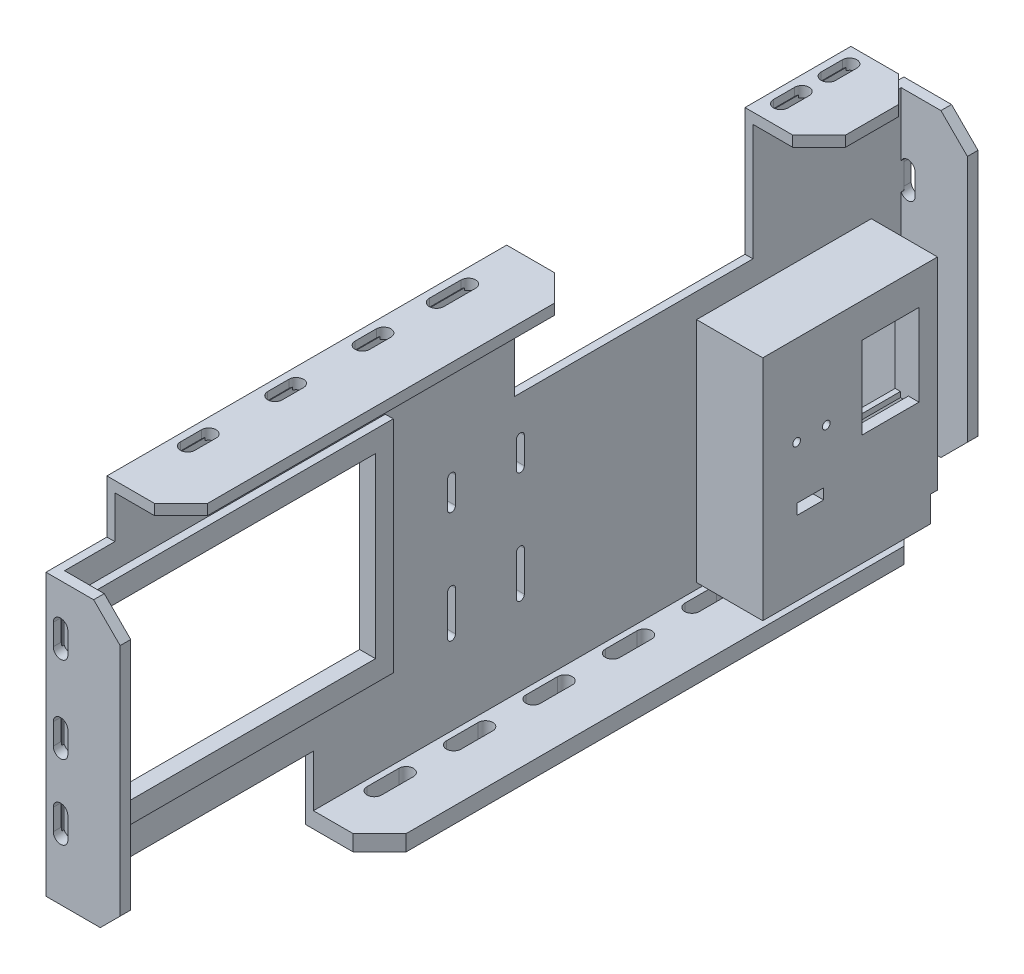
from build123d import *
from build123d.topology import SkipClean

# Parameters (mm, degrees)
SKETCH_1_W           = 80
SKETCH_1_H           = 97
SKETCH_1_W_2         = 60
SKETCH_1_H_2         = 77
EXTRUDE_1_DEPTH      = 6
SKETCH_2_W           = 60
SKETCH_2_H           = 10
EXTRUDE_2_DEPTH      = 25
SKETCH_3_W           = 60
SKETCH_3_H           = 77
EXTRUDE_3_DEPTH      = 4
SKETCH_4_W           = 21.5
SKETCH_4_H           = 31
CUT_EXTRUDE_1_DEPTH  = 4
SKETCH_5_W           = 25.5
SKETCH_5_H           = 35
SKETCH_5_W_2         = 21.5
SKETCH_5_H_2         = 31
EXTRUDE_4_DEPTH      = 5
SKETCH_6_W           = 3
SKETCH_6_H           = 21.5
CUT_EXTRUDE_2_DEPTH  = 37
SKETCH_7_W           = 18.2
SKETCH_7_H           = 30.1
CUT_EXTRUDE_3_DEPTH  = 1.5
SKETCH_8_R           = 1.45
CUT_EXTRUDE_5_DEPTH  = 4.5
FILLET_1_R           = 3
FILLET_2_R           = 3
SKETCH_9_R           = 2.75
CUT_EXTRUDE_6_DEPTH  = 10
SKETCH_10_W          = 60
SKETCH_10_H          = 5
CUT_EXTRUDE_7_DEPTH  = 20
SKETCH_11_W          = 60
SKETCH_11_H          = 10
EXTRUDE_5_DEPTH      = 5
SKETCH_12_R          = 2.7
CUT_EXTRUDE_8_DEPTH  = 5
SKETCH_13_W          = 21
SKETCH_13_H          = 3
CUT_EXTRUDE_9_DEPTH  = 80
SKETCH_14_W          = 174.976992902
SKETCH_14_H          = 186.642125763
CUT_EXTRUDE_11_DEPTH = 22
SKETCH_15_W          = 60
SKETCH_15_H          = 10
SKETCH_15_H_2        = 7
CUT_EXTRUDE_12_DEPTH = 22
SKETCH_19_W          = 328
SKETCH_19_H          = 155.5
SKETCH_19_W_2        = 320
SKETCH_19_H_2        = 147.5
EXTRUDE_6_DEPTH      = 28
SKETCH_20_W          = 66
SKETCH_20_H          = 86
SKETCH_20_W_2        = 60
SKETCH_20_H_2        = 80
EXTRUDE_7_DEPTH      = 28
SKETCH_21_W          = 328
SKETCH_21_H          = 155.5
SKETCH_21_W_2        = 66
SKETCH_21_H_2        = 86
EXTRUDE_8_DEPTH      = 3
CUT_EXTRUDE_13_DEPTH = 3
SKETCH_24_W          = 105.3
SKETCH_24_H          = 67.1
CUT_EXTRUDE_15_DEPTH = 3
SKETCH_26_W          = 121.3
SKETCH_26_H          = 83.1
SKETCH_26_W_2        = 105.3
SKETCH_26_H_2        = 67.1
EXTRUDE_11_DEPTH     = 3
SKETCH_27_W          = 100
SKETCH_27_H          = 25
CUT_EXTRUDE_16_DEPTH = 36
SKETCH_28_W          = 20
SKETCH_28_H          = 20
CUT_EXTRUDE_17_DEPTH = 36
SKETCH_29_W          = 22
SKETCH_29_H          = 22
SKETCH_29_W_2        = 25
CUT_EXTRUDE_18_DEPTH = 36
SKETCH_31_W          = 90
SKETCH_31_H          = 50
CUT_EXTRUDE_19_DEPTH = 36
SKETCH_32_W          = 10
SKETCH_32_H          = 4
CUT_EXTRUDE_20_DEPTH = 36
CUT_EXTRUDE_21_DEPTH = 5
CUT_EXTRUDE_22_DEPTH = 5
CUT_EXTRUDE_23_DEPTH = 5
CUT_EXTRUDE_24_DEPTH = 5
CHAMFER_1_SIZE       = 10
SKETCH_37_W          = 208
SKETCH_37_H          = 2
CUT_EXTRUDE_25_DEPTH = 32
EXTRUDE_12_DEPTH     = 4
CUT_EXTRUDE_26_DEPTH = 2
EXTRUDE_13_DEPTH     = 4
CUT_EXTRUDE_27_DEPTH = 2
EXTRUDE_14_DEPTH     = 4
CUT_EXTRUDE_28_DEPTH = 2
EXTRUDE_15_DEPTH     = 4
SKETCH_45_W          = 106.6
SKETCH_45_H          = 67.076666805
CUT_EXTRUDE_31_DEPTH = 27
SKETCH_46_W          = 98
SKETCH_46_H          = 2.5
CUT_EXTRUDE_32_DEPTH = 27
SKETCH_47_W          = 4
SKETCH_47_H          = 2.5
CUT_EXTRUDE_33_DEPTH = 27
EXTRUDE_16_DEPTH     = 3


with BuildPart() as part:
    # 草图1 → 凸台-拉伸1 (new body)
    with BuildSketch(Plane(origin=(0, 0, 0), x_dir=(0, 0, -1), z_dir=(1, 0, 0))):
        with Locations((40, 48.5)):
            Rectangle(SKETCH_1_W, SKETCH_1_H)
        with Locations((40, 48.5)):
            Rectangle(SKETCH_1_W_2, SKETCH_1_H_2, mode=Mode.SUBTRACT)
    extrude(amount=EXTRUDE_1_DEPTH)

    # 草图2 → 凸台-拉伸2 (add)
    with BuildSketch(Plane(origin=(6, 0, 0), x_dir=(0, 0, -1), z_dir=(1, 0, 0))):
        with Locations((40, 92)):
            Rectangle(SKETCH_2_W, SKETCH_2_H)
        with Locations((40, 5)):
            Rectangle(SKETCH_2_W, SKETCH_2_H)
    extrude(amount=EXTRUDE_2_DEPTH)

    # 草图3 → 凸台-拉伸3 (add)
    with BuildSketch(Plane(origin=(31, 0, 0), x_dir=(0, 0, -1), z_dir=(1, 0, 0))):
        with Locations((40, 48.5)):
            Rectangle(SKETCH_3_W, SKETCH_3_H)
    extrude(amount=-EXTRUDE_3_DEPTH)

    # 草图4 → 切除-拉伸1 (cut)
    with BuildSketch(Plane.ZY.offset(-27)):
        with Locations((-55.25, 61.5)):
            Rectangle(SKETCH_4_W, SKETCH_4_H)
    extrude(amount=-CUT_EXTRUDE_1_DEPTH, mode=Mode.SUBTRACT)

    # 草图5 → 凸台-拉伸4 (add)
    with BuildSketch(Plane.ZY.offset(-27)):
        with Locations((-55.25, 61.5)):
            Rectangle(SKETCH_5_W, SKETCH_5_H)
        with Locations((-55.25, 61.5)):
            Rectangle(SKETCH_5_W_2, SKETCH_5_H_2, mode=Mode.SUBTRACT)
    extrude(amount=EXTRUDE_4_DEPTH)

    # 草图6 → 切除-拉伸2 (cut)
    with BuildSketch(Plane.XZ.offset(-44)):
        with Locations((25.5, -55.25)):
            Rectangle(SKETCH_6_W, SKETCH_6_H)
    extrude(amount=-CUT_EXTRUDE_2_DEPTH, mode=Mode.SUBTRACT)

    # 草图7 → 切除-拉伸3 (cut)
    with BuildSketch(Plane.ZY.offset(-27)):
        with Locations((-25.4, 59.05)):
            Rectangle(SKETCH_7_W, SKETCH_7_H)
    extrude(amount=-CUT_EXTRUDE_3_DEPTH, mode=Mode.SUBTRACT)

    # 草图8 → 切除-拉伸5 (cut)
    with BuildSketch(Plane.ZY.offset(-28.5)):
        with Locations((-31, 56)):
            Circle(SKETCH_8_R)
        with Locations((-19.8, 56)):
            Circle(SKETCH_8_R)
    extrude(amount=-CUT_EXTRUDE_5_DEPTH, mode=Mode.SUBTRACT)

    # 圆角1
    fillet_1_edges = [part.edges().sort_by_distance(p)[0] for p in [
        (0, 0, -40),
    ]]
    fillet(fillet_1_edges, radius=FILLET_1_R)

    # 圆角2
    fillet_2_edges = [part.edges().sort_by_distance(p)[0] for p in [
        (0, 97, -40),
    ]]
    fillet(fillet_2_edges, radius=FILLET_2_R)

    # 草图9 → 切除-拉伸6 (cut)
    with BuildSketch(Plane(origin=(0, 97, 0), x_dir=(1, 0, 0), z_dir=(0, 1, 0))):
        with Locations(Location((6.2, 54, 0), (0, 0, 270))):
            Circle(SKETCH_9_R)
        with Locations(Location((6.2, 46, 0), (0, 0, 270))):
            Circle(SKETCH_9_R)
        with Locations(Location((6.2, 36, 0), (0, 0, 270))):
            Circle(SKETCH_9_R)
        with Locations(Location((6.2, 28, 0), (0, 0, 270))):
            Circle(SKETCH_9_R)
    extrude(amount=-CUT_EXTRUDE_6_DEPTH, mode=Mode.SUBTRACT)

    # 草图10 → 切除-拉伸7 (cut)
    with BuildSketch(Plane.ZY):
        with Locations((-40, 89.5)):
            Rectangle(SKETCH_10_W, SKETCH_10_H)
    extrude(amount=-CUT_EXTRUDE_7_DEPTH, mode=Mode.SUBTRACT)

    # 草图11 → 凸台-拉伸5 (add)
    with BuildSketch(Plane.ZY):
        with Locations((-40, 15)):
            Rectangle(SKETCH_11_W, SKETCH_11_H)
    extrude(amount=-EXTRUDE_5_DEPTH)

    # 草图12 → 切除-拉伸8 (cut)
    with BuildSketch(Plane.ZY):
        with Locations((-61, 14)):
            Circle(SKETCH_12_R)
        with Locations((-46, 14)):
            Circle(SKETCH_12_R)
        with Locations((-30, 14)):
            Circle(SKETCH_12_R)
        with Locations((-15, 14)):
            Circle(SKETCH_12_R)
    extrude(amount=-CUT_EXTRUDE_8_DEPTH, mode=Mode.SUBTRACT)

    # 草图13 → 切除-拉伸9 (cut)
    with BuildSketch(Plane(origin=(0, 0, -70), x_dir=(-1, 0, 0), z_dir=(0, 0, -1))):
        with Locations((-16.5, 8.5)):
            Rectangle(SKETCH_13_W, SKETCH_13_H)
    extrude(amount=-CUT_EXTRUDE_9_DEPTH, mode=Mode.SUBTRACT)

    # 草图14 → 切除-拉伸11 (cut)
    with BuildSketch(Plane.ZY):
        with Locations((-33.745299693, 32.742932649)):
            Rectangle(SKETCH_14_W, SKETCH_14_H)
    extrude(amount=-CUT_EXTRUDE_11_DEPTH, mode=Mode.SUBTRACT)

    # 草图15 → 切除-拉伸12 (cut)
    with BuildSketch(Plane.ZY.offset(-22)):
        with Locations((-40, 92)):
            Rectangle(SKETCH_15_W, SKETCH_15_H)
        with Locations((-40, 3.5)):
            Rectangle(SKETCH_15_W, SKETCH_15_H_2)
    extrude(amount=-CUT_EXTRUDE_12_DEPTH, mode=Mode.SUBTRACT)

    # 草图20 → 凸台-拉伸7 (add)
    with BuildSketch(Plane(origin=(31, 0, 0), x_dir=(0, 0, -1), z_dir=(1, 0, 0))):
        with Locations((40, 47)):
            Rectangle(SKETCH_20_W, SKETCH_20_H)
        with Locations((40, 47)):
            Rectangle(SKETCH_20_W_2, SKETCH_20_H_2, mode=Mode.SUBTRACT)
    extrude(amount=-EXTRUDE_7_DEPTH)



with BuildPart() as body_2:
    # 草图19 → 凸台-拉伸6 (new body)
    with BuildSketch(Plane(origin=(31, 0, 0), x_dir=(0, 0, -1), z_dir=(1, 0, 0))):
        with Locations((-73.71179632, 71.480027444)):
            Rectangle(SKETCH_19_W, SKETCH_19_H)
        with Locations((-73.71179632, 71.480027444)):
            Rectangle(SKETCH_19_W_2, SKETCH_19_H_2, mode=Mode.SUBTRACT)
    extrude(amount=-EXTRUDE_6_DEPTH)


with BuildPart() as part_1:
    add(part.part)

    add(body_2.part)  # 凸台-拉伸8 merges body 2
    # 草图21 → 凸台-拉伸8 (add)
    with BuildSketch(Plane.ZY.offset(-3)):
        with Locations((73.71179632, 71.480027444)):
            Rectangle(SKETCH_21_W, SKETCH_21_H)
        with Locations((-40, 47)):
            Rectangle(SKETCH_21_W_2, SKETCH_21_H_2, mode=Mode.SUBTRACT)
    extrude(amount=-EXTRUDE_8_DEPTH)

    # 草图22 → 切除-拉伸13 (cut)
    with BuildSketch(Plane(origin=(6, 0, 0), x_dir=(0, 0, -1), z_dir=(1, 0, 0))):
        with BuildLine():
            Line((-82.559849638, 84.730027444), (-82.559849638, 74.730027444))
            ThreePointArc((-82.559849638, 74.730027444), (-85.559849638, 71.730027444), (-88.559849638, 74.730027444))
            Line((-88.559849638, 74.730027444), (-88.559849638, 84.730027444))
            ThreePointArc((-88.559849638, 84.730027444), (-85.559849638, 87.730027444), (-82.559849638, 84.730027444))
        make_face()
        with BuildLine():
            Line((-88.559849638, 32.730027444), (-88.559849638, 47.730027444))
            ThreePointArc((-88.559849638, 47.730027444), (-85.559849638, 50.730027444), (-82.559849638, 47.730027444))
            Line((-82.559849638, 47.730027444), (-82.559849638, 32.730027444))
            ThreePointArc((-82.559849638, 32.730027444), (-85.559849638, 29.730027444), (-88.559849638, 32.730027444))
        make_face()
        with BuildLine():
            Line((-62.559849638, 74.725778503), (-62.559849638, 84.725778503))
            ThreePointArc((-62.559849638, 84.725778503), (-59.559849638, 87.725778503), (-56.559849638, 84.725778503))
            Line((-56.559849638, 84.725778503), (-56.559849638, 74.725778503))
            ThreePointArc((-56.559849638, 74.725778503), (-59.559849638, 71.725778503), (-62.559849638, 74.725778503))
        make_face()
        with BuildLine():
            Line((-62.559849638, 32.730027444), (-62.559849638, 47.730027444))
            ThreePointArc((-62.559849638, 47.730027444), (-59.559849638, 50.730027444), (-56.559849638, 47.730027444))
            Line((-56.559849638, 47.730027444), (-56.559849638, 32.730027444))
            ThreePointArc((-56.559849638, 32.730027444), (-59.559849638, 29.730027444), (-62.559849638, 32.730027444))
        make_face()
    extrude(amount=-CUT_EXTRUDE_13_DEPTH, mode=Mode.SUBTRACT)

    # 草图24 → 切除-拉伸15 (cut)
    with BuildSketch(Plane(origin=(6, 0, 0), x_dir=(0, 0, -1), z_dir=(1, 0, 0))):
        with Locations((-171.209849638, 76.280027444)):
            Rectangle(SKETCH_24_W, SKETCH_24_H)
    extrude(amount=-CUT_EXTRUDE_15_DEPTH, mode=Mode.SUBTRACT)

    # 草图26 → 凸台-拉伸11 (add)
    with BuildSketch(Plane(origin=(6, 0, 0), x_dir=(0, 0, -1), z_dir=(1, 0, 0))):
        with Locations((-171.209849638, 76.280027444)):
            Rectangle(SKETCH_26_W, SKETCH_26_H)
        with Locations((-171.209849638, 76.280027444)):
            Rectangle(SKETCH_26_W_2, SKETCH_26_H_2, mode=Mode.SUBTRACT)
    extrude(amount=EXTRUDE_11_DEPTH)

    # 草图27 → 切除-拉伸16 (cut)
    with BuildSketch(Plane(origin=(31, 0, 0), x_dir=(0, 0, -1), z_dir=(1, 0, 0))):
        with Locations((-187.71179632, 6.230027444)):
            Rectangle(SKETCH_27_W, SKETCH_27_H)
    extrude(amount=-CUT_EXTRUDE_16_DEPTH, mode=Mode.SUBTRACT)

    # 草图28 → 切除-拉伸17 (cut)
    with BuildSketch(Plane(origin=(31, 0, 0), x_dir=(0, 0, -1), z_dir=(1, 0, 0))):
        with Locations((80.28820368, 3.730027444)):
            Rectangle(SKETCH_28_W, SKETCH_28_H)
    extrude(amount=-CUT_EXTRUDE_17_DEPTH, mode=Mode.SUBTRACT)

    # 草图29 → 切除-拉伸18 (cut)
    with BuildSketch(Plane(origin=(31, 0, 0), x_dir=(0, 0, -1), z_dir=(1, 0, 0))):
        with Locations((79.28820368, 138.230027444)):
            Rectangle(SKETCH_29_W, SKETCH_29_H)
        with Locations((-225.21179632, 138.230027444)):
            Rectangle(SKETCH_29_W_2, SKETCH_29_H)
    extrude(amount=-CUT_EXTRUDE_18_DEPTH, mode=Mode.SUBTRACT)

    # 草图31 → 切除-拉伸19 (cut)
    with BuildSketch(Plane(origin=(31, 0, 0), x_dir=(0, 0, -1), z_dir=(1, 0, 0))):
        with Locations((-16.71179632, 124.230027444)):
            Rectangle(SKETCH_31_W, SKETCH_31_H)
    extrude(amount=-CUT_EXTRUDE_19_DEPTH, mode=Mode.SUBTRACT)

    # 草图32 → 切除-拉伸20 (cut)
    with BuildSketch(Plane.ZY.offset(-27)):
        with Locations((-25, 34)):
            Rectangle(SKETCH_32_W, SKETCH_32_H)
    extrude(amount=-CUT_EXTRUDE_20_DEPTH, mode=Mode.SUBTRACT)

    # 草图33 → 切除-拉伸21 (cut)
    with BuildSketch(Plane(origin=(0, 149.230027444, 0), x_dir=(1, 0, 0), z_dir=(0, 1, 0))):
        with BuildLine():
            Line((11.25, 62.28820368), (11.25, 54.28820368))
            ThreePointArc((11.25, 54.28820368), (8.5, 51.53820368), (5.75, 54.28820368))
            Line((5.75, 54.28820368), (5.75, 62.28820368))
            ThreePointArc((5.75, 62.28820368), (8.5, 65.03820368), (11.25, 62.28820368))
        make_face()
        with BuildLine():
            Line((11.25, -81.71179632), (11.25, -93.71179632))
            ThreePointArc((11.25, -93.71179632), (8.5, -96.46179632), (5.75, -93.71179632))
            Line((5.75, -93.71179632), (5.75, -81.71179632))
            ThreePointArc((5.75, -81.71179632), (8.5, -78.96179632), (11.25, -81.71179632))
        make_face()
        with BuildLine():
            Line((11.25, -113.71179632), (11.25, -121.71179632))
            ThreePointArc((11.25, -121.71179632), (8.5, -124.46179632), (5.75, -121.71179632))
            Line((5.75, -121.71179632), (5.75, -113.71179632))
            ThreePointArc((5.75, -113.71179632), (8.5, -110.96179632), (11.25, -113.71179632))
        make_face()
        with BuildLine():
            Line((11.25, -146.71179632), (11.25, -154.71179632))
            ThreePointArc((11.25, -154.71179632), (8.5, -157.46179632), (5.75, -154.71179632))
            Line((5.75, -154.71179632), (5.75, -146.71179632))
            ThreePointArc((5.75, -146.71179632), (8.5, -143.96179632), (11.25, -146.71179632))
        make_face()
        with BuildLine():
            Line((11.25, -179.71179632), (11.25, -187.71179632))
            ThreePointArc((11.25, -187.71179632), (8.5, -190.46179632), (5.75, -187.71179632))
            Line((5.75, -187.71179632), (5.75, -179.71179632))
            ThreePointArc((5.75, -179.71179632), (8.5, -176.96179632), (11.25, -179.71179632))
        make_face()
        with BuildLine():
            Line((11.25, 44.28820368), (11.25, 36.28820368))
            ThreePointArc((11.25, 36.28820368), (8.5, 33.53820368), (5.75, 36.28820368))
            Line((5.75, 36.28820368), (5.75, 44.28820368))
            ThreePointArc((5.75, 44.28820368), (8.5, 47.03820368), (11.25, 44.28820368))
        make_face()
    extrude(amount=-CUT_EXTRUDE_21_DEPTH, mode=Mode.SUBTRACT)

    # 草图34 → 切除-拉伸22 (cut)
    with BuildSketch(Plane(origin=(0, 0, -90.28820368), x_dir=(-1, 0, 0), z_dir=(0, 0, -1))):
        with BuildLine():
            Line((-5.75, 102.230027444), (-5.75, 94.230027444))
            ThreePointArc((-5.75, 94.230027444), (-8.5, 91.480027444), (-11.25, 94.230027444))
            Line((-11.25, 94.230027444), (-11.25, 102.230027444))
            ThreePointArc((-11.25, 102.230027444), (-8.5, 104.980027444), (-5.75, 102.230027444))
        make_face()
        with BuildLine():
            Line((-5.75, 64.730027444), (-5.75, 56.730027444))
            ThreePointArc((-5.75, 56.730027444), (-8.5, 53.980027444), (-11.25, 56.730027444))
            Line((-11.25, 56.730027444), (-11.25, 64.730027444))
            ThreePointArc((-11.25, 64.730027444), (-8.5, 67.480027444), (-5.75, 64.730027444))
        make_face()
        with BuildLine():
            Line((-5.75, 31.730027444), (-5.75, 23.730027444))
            ThreePointArc((-5.75, 23.730027444), (-8.5, 20.980027444), (-11.25, 23.730027444))
            Line((-11.25, 23.730027444), (-11.25, 31.730027444))
            ThreePointArc((-11.25, 31.730027444), (-8.5, 34.480027444), (-5.75, 31.730027444))
        make_face()
    extrude(amount=-CUT_EXTRUDE_22_DEPTH, mode=Mode.SUBTRACT)

    # 草图35 → 切除-拉伸23 (cut)
    with BuildSketch(Plane.XY.offset(237.71179632)):
        with BuildLine():
            Line((11.25, 112.230027444), (11.25, 104.230027444))
            ThreePointArc((11.25, 104.230027444), (8.5, 101.480027444), (5.75, 104.230027444))
            Line((5.75, 104.230027444), (5.75, 112.230027444))
            ThreePointArc((5.75, 112.230027444), (8.5, 114.980027444), (11.25, 112.230027444))
        make_face()
        with BuildLine():
            Line((11.25, 79.730027444), (11.25, 71.730027444))
            ThreePointArc((11.25, 71.730027444), (8.5, 68.980027444), (5.75, 71.730027444))
            Line((5.75, 71.730027444), (5.75, 79.730027444))
            ThreePointArc((5.75, 79.730027444), (8.5, 82.480027444), (11.25, 79.730027444))
        make_face()
        with BuildLine():
            Line((11.25, 51.730027444), (11.25, 43.730027444))
            ThreePointArc((11.25, 43.730027444), (8.5, 40.980027444), (5.75, 43.730027444))
            Line((5.75, 43.730027444), (5.75, 51.730027444))
            ThreePointArc((5.75, 51.730027444), (8.5, 54.480027444), (11.25, 51.730027444))
        make_face()
    extrude(amount=-CUT_EXTRUDE_23_DEPTH, mode=Mode.SUBTRACT)

    # 草图36 → 切除-拉伸24 (cut)
    with BuildSketch(Plane.XZ.offset(6.269972556)):
        with BuildLine():
            Line((13.75, 119.71179632), (13.75, 107.71179632))
            ThreePointArc((13.75, 107.71179632), (11, 104.96179632), (8.25, 107.71179632))
            Line((8.25, 107.71179632), (8.25, 119.71179632))
            ThreePointArc((8.25, 119.71179632), (11, 122.46179632), (13.75, 119.71179632))
        make_face()
        with BuildLine():
            Line((13.75, 89.71179632), (13.75, 77.71179632))
            ThreePointArc((13.75, 77.71179632), (11, 74.96179632), (8.25, 77.71179632))
            Line((8.25, 77.71179632), (8.25, 89.71179632))
            ThreePointArc((8.25, 89.71179632), (11, 92.46179632), (13.75, 89.71179632))
        make_face()
        with BuildLine():
            Line((13.75, 59.71179632), (13.75, 47.71179632))
            ThreePointArc((13.75, 47.71179632), (11, 44.96179632), (8.25, 47.71179632))
            Line((8.25, 47.71179632), (8.25, 59.71179632))
            ThreePointArc((8.25, 59.71179632), (11, 62.46179632), (13.75, 59.71179632))
        make_face()
        with BuildLine():
            Line((13.75, 29.71179632), (13.75, 17.71179632))
            ThreePointArc((13.75, 17.71179632), (11, 14.96179632), (8.25, 17.71179632))
            Line((8.25, 17.71179632), (8.25, 29.71179632))
            ThreePointArc((8.25, 29.71179632), (11, 32.46179632), (13.75, 29.71179632))
        make_face()
        with BuildLine():
            Line((13.75, -0.28820368), (13.75, -12.28820368))
            ThreePointArc((13.75, -12.28820368), (11, -15.03820368), (8.25, -12.28820368))
            Line((8.25, -12.28820368), (8.25, -0.28820368))
            ThreePointArc((8.25, -0.28820368), (11, 2.46179632), (13.75, -0.28820368))
        make_face()
        with BuildLine():
            Line((13.75, -30.28820368), (13.75, -42.28820368))
            ThreePointArc((13.75, -42.28820368), (11, -45.03820368), (8.25, -42.28820368))
            Line((8.25, -42.28820368), (8.25, -30.28820368))
            ThreePointArc((8.25, -30.28820368), (11, -27.53820368), (13.75, -30.28820368))
        make_face()
    extrude(amount=-CUT_EXTRUDE_24_DEPTH, mode=Mode.SUBTRACT)

    # 倒角1
    chamfer_1_edges = [part_1.edges().sort_by_distance(p)[0] for p in [
        (31, 18.730027444, 235.71179632),
        (31, -4.269972556, 137.71179632),
        (31, 13.730027444, -88.28820368),
        (31, -4.269972556, -70.28820368),
        (31, 147.230027444, 212.71179632),
        (31, 127.230027444, -88.28820368),
        (31, 147.230027444, -68.28820368),
        (31, 127.230027444, 235.71179632),
        (31, 147.230027444, -28.28820368),
        (31, 147.230027444, 61.71179632),
    ]]
    chamfer(chamfer_1_edges, length=CHAMFER_1_SIZE)

    # 草图37 → 切除-拉伸25 (cut)
    with BuildSketch(Plane(origin=(31, 0, 0), x_dir=(0, 0, -1), z_dir=(1, 0, 0))):
        with Locations((-33.71179632, -5.269972556)):
            Rectangle(SKETCH_37_W, SKETCH_37_H)
    extrude(amount=-CUT_EXTRUDE_25_DEPTH, mode=Mode.SUBTRACT)

    # 草图38 → 凸台-拉伸12 (add)
    with BuildSketch(Plane(origin=(0, -2.269972556, 0), x_dir=(1, 0, 0), z_dir=(0, 1, 0))):
        Polygon((6, -137.71179632), (21, -137.71179632), (31, -127.71179632), (31, 60.28820368), (21, 70.28820368), (6, 70.28820368), align=None)
        with BuildLine():
            Line((8.25, -119.71179632), (8.25, -107.71179632))
            ThreePointArc((8.25, -107.71179632), (11, -104.96179632), (13.75, -107.71179632))
            Line((13.75, -107.71179632), (13.75, -119.71179632))
            ThreePointArc((13.75, -119.71179632), (11, -122.46179632), (8.25, -119.71179632))
        make_face(mode=Mode.SUBTRACT)
        with BuildLine():
            Line((13.75, -77.71179632), (13.75, -89.71179632))
            ThreePointArc((13.75, -89.71179632), (11, -92.46179632), (8.25, -89.71179632))
            Line((8.25, -89.71179632), (8.25, -77.71179632))
            ThreePointArc((8.25, -77.71179632), (11, -74.96179632), (13.75, -77.71179632))
        make_face(mode=Mode.SUBTRACT)
        with BuildLine():
            Line((8.25, -59.71179632), (8.25, -47.71179632))
            ThreePointArc((8.25, -47.71179632), (11, -44.96179632), (13.75, -47.71179632))
            Line((13.75, -47.71179632), (13.75, -59.71179632))
            ThreePointArc((13.75, -59.71179632), (11, -62.46179632), (8.25, -59.71179632))
        make_face(mode=Mode.SUBTRACT)
        with BuildLine():
            Line((8.25, -29.71179632), (8.25, -17.71179632))
            ThreePointArc((8.25, -17.71179632), (11, -14.96179632), (13.75, -17.71179632))
            Line((13.75, -17.71179632), (13.75, -29.71179632))
            ThreePointArc((13.75, -29.71179632), (11, -32.46179632), (8.25, -29.71179632))
        make_face(mode=Mode.SUBTRACT)
        with BuildLine():
            Line((13.75, 12.28820368), (13.75, 0.28820368))
            ThreePointArc((13.75, 0.28820368), (11, -2.46179632), (8.25, 0.28820368))
            Line((8.25, 0.28820368), (8.25, 12.28820368))
            ThreePointArc((8.25, 12.28820368), (11, 15.03820368), (13.75, 12.28820368))
        make_face(mode=Mode.SUBTRACT)
        with BuildLine():
            Line((8.25, 30.28820368), (8.25, 42.28820368))
            ThreePointArc((8.25, 42.28820368), (11, 45.03820368), (13.75, 42.28820368))
            Line((13.75, 42.28820368), (13.75, 30.28820368))
            ThreePointArc((13.75, 30.28820368), (11, 27.53820368), (8.25, 30.28820368))
        make_face(mode=Mode.SUBTRACT)
    extrude(amount=EXTRUDE_12_DEPTH)

    # 草图39 → 切除-拉伸26 (cut)
    # profile 1 of 2: a face of its own
    with BuildSketch(Plane(origin=(0, 149.230027444, 0), x_dir=(1, 0, 0), z_dir=(0, 1, 0))):
        Polygon((3, 68.28820368), (3, 28.28820368), (21, 28.28820368), (31, 38.28820368), (31, 58.28820368), (21, 68.28820368), align=None)
        with BuildLine():
            Line((11.25, 44.28820368), (11.25, 36.28820368))
            ThreePointArc((11.25, 36.28820368), (8.5, 33.53820368), (5.75, 36.28820368))
            Line((5.75, 36.28820368), (5.75, 44.28820368))
            ThreePointArc((5.75, 44.28820368), (8.5, 47.03820368), (11.25, 44.28820368))
        make_face(mode=Mode.SUBTRACT)
        with BuildLine():
            Line((5.75, 54.28820368), (5.75, 62.28820368))
            ThreePointArc((5.75, 62.28820368), (8.5, 65.03820368), (11.25, 62.28820368))
            Line((11.25, 62.28820368), (11.25, 54.28820368))
            ThreePointArc((11.25, 54.28820368), (8.5, 51.53820368), (5.75, 54.28820368))
        make_face(mode=Mode.SUBTRACT)
    # profile 2 of 2: a face of its own
    with BuildSketch(Plane(origin=(0, 149.230027444, 0), x_dir=(1, 0, 0), z_dir=(0, 1, 0))):
        Polygon((21, -212.71179632), (31, -202.71179632), (31, -71.71179632), (21, -61.71179632), (3, -61.71179632), (3, -212.71179632), align=None)
        with BuildLine():
            Line((11.25, -179.71179632), (11.25, -187.71179632))
            ThreePointArc((11.25, -187.71179632), (8.5, -190.46179632), (5.75, -187.71179632))
            Line((5.75, -187.71179632), (5.75, -179.71179632))
            ThreePointArc((5.75, -179.71179632), (8.5, -176.96179632), (11.25, -179.71179632))
        make_face(mode=Mode.SUBTRACT)
        with BuildLine():
            Line((5.75, -154.71179632), (5.75, -146.71179632))
            ThreePointArc((5.75, -146.71179632), (8.5, -143.96179632), (11.25, -146.71179632))
            Line((11.25, -146.71179632), (11.25, -154.71179632))
            ThreePointArc((11.25, -154.71179632), (8.5, -157.46179632), (5.75, -154.71179632))
        make_face(mode=Mode.SUBTRACT)
        with BuildLine():
            ThreePointArc((11.25, -121.71179632), (9.08630197, -124.398569477), (6, -122.857440244))
            ThreePointArc((6, -122.857440244), (5.813226842, -122.29809829), (5.75, -121.71179632))
            Line((5.75, -121.71179632), (5.75, -113.71179632))
            ThreePointArc((5.75, -113.71179632), (5.813226842, -113.12549435), (6, -112.566152396))
            ThreePointArc((6, -112.566152396), (9.08630197, -111.025023162), (11.25, -113.71179632))
            Line((11.25, -113.71179632), (11.25, -121.71179632))
        make_face(mode=Mode.SUBTRACT)
        with BuildLine():
            Line((5.75, -93.71179632), (5.75, -81.71179632))
            ThreePointArc((5.75, -81.71179632), (8.5, -78.96179632), (11.25, -81.71179632))
            Line((11.25, -81.71179632), (11.25, -93.71179632))
            ThreePointArc((11.25, -93.71179632), (8.5, -96.46179632), (5.75, -93.71179632))
        make_face(mode=Mode.SUBTRACT)
    extrude(amount=-CUT_EXTRUDE_26_DEPTH, mode=Mode.SUBTRACT)

    # 草图40 → 凸台-拉伸13 (add)
    # profile 1 of 2: a face of its own
    with SkipClean():  # the faces are left unmerged after this step: merging them gives an invalid solid
        with BuildSketch(Plane(origin=(0, 147.230027444, 0), x_dir=(1, 0, 0), z_dir=(0, 1, 0))):
            Polygon((21, 68.28820368), (3, 68.28820368), (3, 28.28820368), (21, 28.28820368), (31, 38.28820368), (31, 58.28820368), align=None)
            with BuildLine():
                Line((5.75, 44.28820368), (5.75, 36.28820368))
                ThreePointArc((5.75, 36.28820368), (8.5, 33.53820368), (11.25, 36.28820368))
                Line((11.25, 36.28820368), (11.25, 44.28820368))
                ThreePointArc((11.25, 44.28820368), (8.5, 47.03820368), (5.75, 44.28820368))
            make_face(mode=Mode.SUBTRACT)
            with BuildLine():
                Line((5.75, 62.28820368), (5.75, 54.28820368))
                ThreePointArc((5.75, 54.28820368), (8.5, 51.53820368), (11.25, 54.28820368))
                Line((11.25, 54.28820368), (11.25, 62.28820368))
                ThreePointArc((11.25, 62.28820368), (8.5, 65.03820368), (5.75, 62.28820368))
            make_face(mode=Mode.SUBTRACT)
        # profile 2 of 2: a face of its own
        with BuildSketch(Plane(origin=(0, 147.230027444, 0), x_dir=(1, 0, 0), z_dir=(0, 1, 0))):
            Polygon((21, -212.71179632), (31, -202.71179632), (31, -71.71179632), (21, -61.71179632), (3, -61.71179632), (3, -212.71179632), align=None)
            with BuildLine():
                Line((5.75, -187.71179632), (5.75, -179.71179632))
                ThreePointArc((5.75, -179.71179632), (8.5, -176.96179632), (11.25, -179.71179632))
                Line((11.25, -179.71179632), (11.25, -187.71179632))
                ThreePointArc((11.25, -187.71179632), (8.5, -190.46179632), (5.75, -187.71179632))
            make_face(mode=Mode.SUBTRACT)
            with BuildLine():
                Line((5.75, -154.71179632), (5.75, -146.71179632))
                ThreePointArc((5.75, -146.71179632), (8.5, -143.96179632), (11.25, -146.71179632))
                Line((11.25, -146.71179632), (11.25, -154.71179632))
                ThreePointArc((11.25, -154.71179632), (8.5, -157.46179632), (5.75, -154.71179632))
            make_face(mode=Mode.SUBTRACT)
            with BuildLine():
                Line((11.25, -113.71179632), (11.25, -121.71179632))
                ThreePointArc((11.25, -121.71179632), (8.5, -124.46179632), (5.75, -121.71179632))
                Line((5.75, -121.71179632), (5.75, -113.71179632))
                ThreePointArc((5.75, -113.71179632), (8.5, -110.96179632), (11.25, -113.71179632))
            make_face(mode=Mode.SUBTRACT)
            with BuildLine():
                Line((11.25, -81.71179632), (11.25, -93.71179632))
                ThreePointArc((11.25, -93.71179632), (8.5, -96.46179632), (5.75, -93.71179632))
                Line((5.75, -93.71179632), (5.75, -81.71179632))
                ThreePointArc((5.75, -81.71179632), (8.5, -78.96179632), (11.25, -81.71179632))
            make_face(mode=Mode.SUBTRACT)
        extrude(amount=-EXTRUDE_13_DEPTH)
    add(part_1.part.scale(1), mode=Mode.REPLACE)  # the faces are merged on a copy

    # 草图41 → 切除-拉伸27 (cut)
    with BuildSketch(Plane(origin=(0, 0, -90.28820368), x_dir=(-1, 0, 0), z_dir=(0, 0, -1))):
        Polygon((-31, 117.230027444), (-31, 23.730027444), (-21, 13.730027444), (-3, 13.730027444), (-3, 127.230027444), (-21, 127.230027444), align=None)
        with BuildLine():
            Line((-5.75, 23.730027444), (-5.75, 31.730027444))
            ThreePointArc((-5.75, 31.730027444), (-8.5, 34.480027444), (-11.25, 31.730027444))
            Line((-11.25, 31.730027444), (-11.25, 23.730027444))
            ThreePointArc((-11.25, 23.730027444), (-8.5, 20.980027444), (-5.75, 23.730027444))
        make_face(mode=Mode.SUBTRACT)
        with BuildLine():
            Line((-5.75, 56.730027444), (-5.75, 64.730027444))
            ThreePointArc((-5.75, 64.730027444), (-8.5, 67.480027444), (-11.25, 64.730027444))
            Line((-11.25, 64.730027444), (-11.25, 56.730027444))
            ThreePointArc((-11.25, 56.730027444), (-8.5, 53.980027444), (-5.75, 56.730027444))
        make_face(mode=Mode.SUBTRACT)
        with BuildLine():
            Line((-5.75, 94.230027444), (-5.75, 102.230027444))
            ThreePointArc((-5.75, 102.230027444), (-8.5, 104.980027444), (-11.25, 102.230027444))
            Line((-11.25, 102.230027444), (-11.25, 94.230027444))
            ThreePointArc((-11.25, 94.230027444), (-8.5, 91.480027444), (-5.75, 94.230027444))
        make_face(mode=Mode.SUBTRACT)
    extrude(amount=-CUT_EXTRUDE_27_DEPTH, mode=Mode.SUBTRACT)

    # 草图42 → 凸台-拉伸14 (add)
    with SkipClean():  # the faces are left unmerged after this step: merging them gives an invalid solid
        with BuildSketch(Plane(origin=(0, 0, -88.28820368), x_dir=(-1, 0, 0), z_dir=(0, 0, -1))):
            Polygon((-21, 127.230027444), (-31, 117.230027444), (-31, 23.730027444), (-21, 13.730027444), (-3, 13.730027444), (-3, 127.230027444), align=None)
            with BuildLine():
                Line((-5.75, 23.730027444), (-5.75, 31.730027444))
                ThreePointArc((-5.75, 31.730027444), (-8.5, 34.480027444), (-11.25, 31.730027444))
                Line((-11.25, 31.730027444), (-11.25, 23.730027444))
                ThreePointArc((-11.25, 23.730027444), (-8.5, 20.980027444), (-5.75, 23.730027444))
            make_face(mode=Mode.SUBTRACT)
            with BuildLine():
                Line((-5.75, 56.730027444), (-5.75, 64.730027444))
                ThreePointArc((-5.75, 64.730027444), (-8.5, 67.480027444), (-11.25, 64.730027444))
                Line((-11.25, 64.730027444), (-11.25, 56.730027444))
                ThreePointArc((-11.25, 56.730027444), (-8.5, 53.980027444), (-5.75, 56.730027444))
            make_face(mode=Mode.SUBTRACT)
            with BuildLine():
                Line((-5.75, 94.230027444), (-5.75, 102.230027444))
                ThreePointArc((-5.75, 102.230027444), (-8.5, 104.980027444), (-11.25, 102.230027444))
                Line((-11.25, 102.230027444), (-11.25, 94.230027444))
                ThreePointArc((-11.25, 94.230027444), (-8.5, 91.480027444), (-5.75, 94.230027444))
            make_face(mode=Mode.SUBTRACT)
        extrude(amount=-EXTRUDE_14_DEPTH)
    add(part_1.part.scale(1), mode=Mode.REPLACE)  # the faces are merged on a copy

    # 草图43 → 切除-拉伸28 (cut)
    with BuildSketch(Plane.XY.offset(237.71179632)):
        Polygon((31, 28.730027444), (31, 117.230027444), (21, 127.230027444), (3, 127.230027444), (3, 18.730027444), (21, 18.730027444), align=None)
        with BuildLine():
            Line((5.75, 51.730027444), (5.75, 43.730027444))
            ThreePointArc((5.75, 43.730027444), (8.5, 40.980027444), (11.25, 43.730027444))
            Line((11.25, 43.730027444), (11.25, 51.730027444))
            ThreePointArc((11.25, 51.730027444), (8.5, 54.480027444), (5.75, 51.730027444))
        make_face(mode=Mode.SUBTRACT)
        with BuildLine():
            Line((5.75, 79.730027444), (5.75, 71.730027444))
            ThreePointArc((5.75, 71.730027444), (8.5, 68.980027444), (11.25, 71.730027444))
            Line((11.25, 71.730027444), (11.25, 79.730027444))
            ThreePointArc((11.25, 79.730027444), (8.5, 82.480027444), (5.75, 79.730027444))
        make_face(mode=Mode.SUBTRACT)
        with BuildLine():
            Line((5.75, 112.230027444), (5.75, 104.230027444))
            ThreePointArc((5.75, 104.230027444), (8.5, 101.480027444), (11.25, 104.230027444))
            Line((11.25, 104.230027444), (11.25, 112.230027444))
            ThreePointArc((11.25, 112.230027444), (8.5, 114.980027444), (5.75, 112.230027444))
        make_face(mode=Mode.SUBTRACT)
    extrude(amount=-CUT_EXTRUDE_28_DEPTH, mode=Mode.SUBTRACT)

    # 草图44 → 凸台-拉伸15 (add)
    with BuildSketch(Plane.XY.offset(235.71179632)):
        Polygon((3, 18.730027444), (21, 18.730027444), (31, 28.730027444), (31, 117.230027444), (21, 127.230027444), (3, 127.230027444), align=None)
        with BuildLine():
            ThreePointArc((5.75, 51.730027444), (8.5, 54.480027444), (11.25, 51.730027444))
            Line((11.25, 51.730027444), (11.25, 43.730027444))
            ThreePointArc((11.25, 43.730027444), (8.5, 40.980027444), (5.75, 43.730027444))
            Line((5.75, 43.730027444), (5.75, 51.730027444))
        make_face(mode=Mode.SUBTRACT)
        with BuildLine():
            ThreePointArc((5.75, 79.730027444), (8.5, 82.480027444), (11.25, 79.730027444))
            Line((11.25, 79.730027444), (11.25, 71.730027444))
            ThreePointArc((11.25, 71.730027444), (8.5, 68.980027444), (5.75, 71.730027444))
            Line((5.75, 71.730027444), (5.75, 79.730027444))
        make_face(mode=Mode.SUBTRACT)
        with BuildLine():
            ThreePointArc((5.75, 112.230027444), (8.5, 114.980027444), (11.25, 112.230027444))
            Line((11.25, 112.230027444), (11.25, 104.230027444))
            ThreePointArc((11.25, 104.230027444), (8.5, 101.480027444), (5.75, 104.230027444))
            Line((5.75, 104.230027444), (5.75, 112.230027444))
        make_face(mode=Mode.SUBTRACT)
    extrude(amount=-EXTRUDE_15_DEPTH)

    # 草图45 → 切除-拉伸31 (cut)
    with BuildSketch(Plane(origin=(9, 0, 0), x_dir=(0, 0, -1), z_dir=(1, 0, 0))):
        with Locations((-170.559849638, 76.268360847)):
            Rectangle(SKETCH_45_W, SKETCH_45_H)
    extrude(amount=-CUT_EXTRUDE_31_DEPTH, mode=Mode.SUBTRACT)

    # 草图46 → 切除-拉伸32 (cut)
    with BuildSketch(Plane(origin=(6, 0, 0), x_dir=(0, 0, -1), z_dir=(1, 0, 0))):
        with Locations((-186.71179632, 19.980027444)):
            Rectangle(SKETCH_46_W, SKETCH_46_H)
    extrude(amount=-CUT_EXTRUDE_32_DEPTH, mode=Mode.SUBTRACT)

    # 草图47 → 切除-拉伸33 (cut)
    with BuildSketch(Plane.ZY.offset(-6)):
        with Locations((233.71179632, 19.980027444)):
            Rectangle(SKETCH_47_W, SKETCH_47_H)
    extrude(amount=-CUT_EXTRUDE_33_DEPTH, mode=Mode.SUBTRACT)

    # 草图48 → 凸台-拉伸16 (add)
    # profile 1 of 4: a face of its own
    with BuildSketch(Plane(origin=(6, 0, 0), x_dir=(0, 0, -1), z_dir=(1, 0, 0))):
        with BuildLine():
            Line((-56.559849638, 32.730027444), (-56.559849638, 47.730027444))
            ThreePointArc((-56.559849638, 47.730027444), (-59.559849638, 50.730027444), (-62.559849638, 47.730027444))
            Line((-62.559849638, 47.730027444), (-62.559849638, 32.730027444))
            ThreePointArc((-62.559849638, 32.730027444), (-59.559849638, 29.730027444), (-56.559849638, 32.730027444))
        make_face()
        with BuildLine():
            Line((-58.059849638, 47.730027444), (-58.059849638, 32.730027444))
            ThreePointArc((-58.059849638, 32.730027444), (-59.559849638, 31.230027444), (-61.059849638, 32.730027444))
            Line((-61.059849638, 32.730027444), (-61.059849638, 47.730027444))
            ThreePointArc((-61.059849638, 47.730027444), (-59.559849638, 49.230027444), (-58.059849638, 47.730027444))
        make_face(mode=Mode.SUBTRACT)
    # profile 2 of 4: a face of its own
    with BuildSketch(Plane(origin=(6, 0, 0), x_dir=(0, 0, -1), z_dir=(1, 0, 0))):
        with BuildLine():
            Line((-88.559849638, 47.730027444), (-88.559849638, 32.730027444))
            ThreePointArc((-88.559849638, 32.730027444), (-85.559849638, 29.730027444), (-82.559849638, 32.730027444))
            Line((-82.559849638, 32.730027444), (-82.559849638, 47.730027444))
            ThreePointArc((-82.559849638, 47.730027444), (-85.559849638, 50.730027444), (-88.559849638, 47.730027444))
        make_face()
        with BuildLine():
            Line((-84.059849638, 47.730027444), (-84.059849638, 32.730027444))
            ThreePointArc((-84.059849638, 32.730027444), (-85.559849638, 31.230027444), (-87.059849638, 32.730027444))
            Line((-87.059849638, 32.730027444), (-87.059849638, 47.730027444))
            ThreePointArc((-87.059849638, 47.730027444), (-85.559849638, 49.230027444), (-84.059849638, 47.730027444))
        make_face(mode=Mode.SUBTRACT)
    # profile 3 of 4: a face of its own
    with BuildSketch(Plane(origin=(6, 0, 0), x_dir=(0, 0, -1), z_dir=(1, 0, 0))):
        with BuildLine():
            Line((-62.559849638, 84.725778503), (-62.559849638, 74.725778503))
            ThreePointArc((-62.559849638, 74.725778503), (-59.559849638, 71.725778503), (-56.559849638, 74.725778503))
            Line((-56.559849638, 74.725778503), (-56.559849638, 84.725778503))
            ThreePointArc((-56.559849638, 84.725778503), (-59.559849638, 87.725778503), (-62.559849638, 84.725778503))
        make_face()
        with BuildLine():
            Line((-58.059849638, 84.725778503), (-58.059849638, 74.730027444))
            ThreePointArc((-58.059849638, 74.730027444), (-59.559849638, 73.230027444), (-61.059849638, 74.730027444))
            Line((-61.059849638, 74.730027444), (-61.059849638, 84.725778503))
            ThreePointArc((-61.059849638, 84.725778503), (-59.559849638, 86.225778503), (-58.059849638, 84.725778503))
        make_face(mode=Mode.SUBTRACT)
    # profile 4 of 4: a face of its own
    with BuildSketch(Plane(origin=(6, 0, 0), x_dir=(0, 0, -1), z_dir=(1, 0, 0))):
        with BuildLine():
            Line((-82.559849638, 74.730027444), (-82.559849638, 84.730027444))
            ThreePointArc((-82.559849638, 84.730027444), (-85.559849638, 87.730027444), (-88.559849638, 84.730027444))
            Line((-88.559849638, 84.730027444), (-88.559849638, 74.730027444))
            ThreePointArc((-88.559849638, 74.730027444), (-85.559849638, 71.730027444), (-82.559849638, 74.730027444))
        make_face()
        with BuildLine():
            Line((-84.059849638, 84.730027444), (-84.059849638, 74.730027444))
            ThreePointArc((-84.059849638, 74.730027444), (-85.559849638, 73.230027444), (-87.059849638, 74.730027444))
            Line((-87.059849638, 74.730027444), (-87.059849638, 84.730027444))
            ThreePointArc((-87.059849638, 84.730027444), (-85.559849638, 86.230027444), (-84.059849638, 84.730027444))
        make_face(mode=Mode.SUBTRACT)
    extrude(amount=-EXTRUDE_16_DEPTH)


solid = part_1.part
